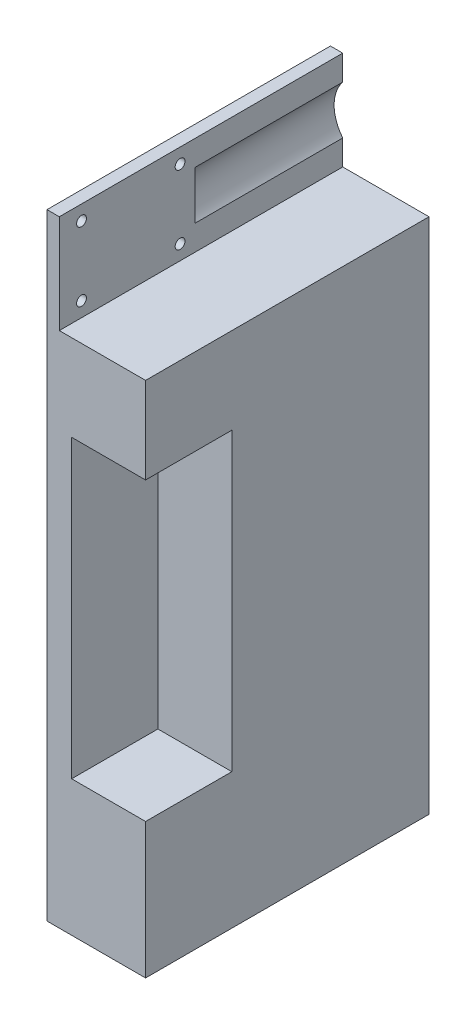
from build123d import *

# Parameters (mm, degrees)
BOSS_EXTRUDE1_DEPTH = 115
SKETCH2_R           = 2
CUT_EXTRUDE1_DEPTH  = 243.744721879
SKETCH3_R           = 15.5
CUT_EXTRUDE2_DEPTH  = 60
SKETCH4_W           = 35
SKETCH4_H           = 120
CUT_EXTRUDE3_DEPTH  = 30


with BuildPart() as part:
    # Sketch1 → Boss-Extrude1 (new body)
    with BuildSketch(Plane.XY):
        Polygon((0, 0), (0, 40), (-5, 40), (-5, -210), (35, -210), (35, 0), align=None)
    extrude(amount=BOSS_EXTRUDE1_DEPTH)

    # Sketch2 → Cut-Extrude1 (cut, through all)
    with BuildSketch(Plane.ZY.offset(5)):
        with Locations((106, 34)):
            Circle(SKETCH2_R)
        with Locations((66, 34)):
            Circle(SKETCH2_R)
        with Locations((66, 6)):
            Circle(SKETCH2_R)
        with Locations((106, 6)):
            Circle(SKETCH2_R)
    extrude(amount=-CUT_EXTRUDE1_DEPTH, mode=Mode.SUBTRACT)

    # Sketch3 → Cut-Extrude2 (cut)
    with BuildSketch(Plane(origin=(0, 0, 0), x_dir=(-1, 0, 0), z_dir=(0, 0, -1))):
        with Locations((-12, 20)):
            Circle(SKETCH3_R)
    extrude(amount=-CUT_EXTRUDE2_DEPTH, mode=Mode.SUBTRACT)

    # Sketch4 → Cut-Extrude3 (cut)
    with BuildSketch(Plane(origin=(35, 0, 0), x_dir=(0, 0, -1), z_dir=(1, 0, 0))):
        with Locations((-97.5, -95)):
            Rectangle(SKETCH4_W, SKETCH4_H)
    extrude(amount=-CUT_EXTRUDE3_DEPTH, mode=Mode.SUBTRACT)


solid = part.part
